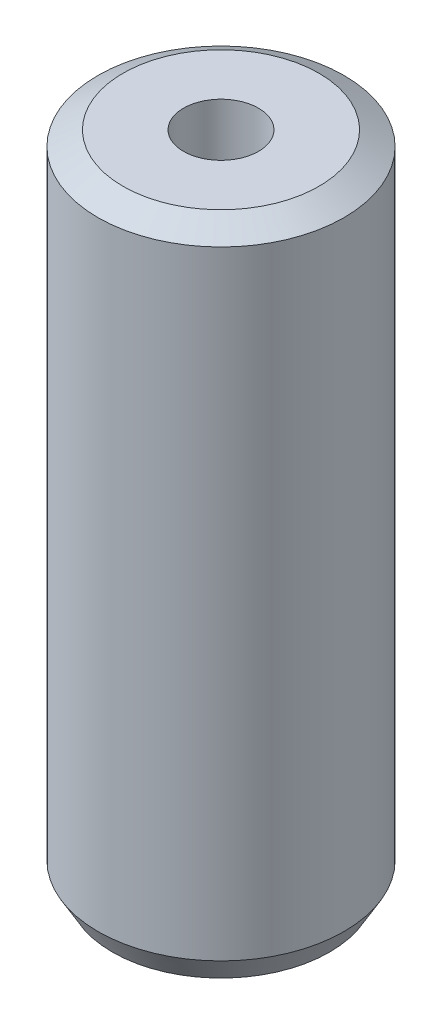
from build123d import *
from OCP.BRepFilletAPI import BRepFilletAPI_MakeChamfer

# Parameters (mm, degrees)
SKETCH1_R           = 10
BOSS_EXTRUDE1_DEPTH = 53.444503897
SKETCH2_R           = 3.044785515
CUT_EXTRUDE1_DEPTH  = 56.283948817
CHAMFER1_SIZE       = 1.177911694
CHAMFER1_SIZE2      = 2.040202901


with BuildPart() as part:
    # Sketch1 → Boss-Extrude1 (new body)
    with BuildSketch(Plane(origin=(0, 0, 0), x_dir=(1, 0, 0), z_dir=(0, 1, 0))):
        Circle(SKETCH1_R)
    extrude(amount=BOSS_EXTRUDE1_DEPTH)

    # Sketch2 → Cut-Extrude1 (cut, through all)
    with BuildSketch(Plane(origin=(0, 0, 0), x_dir=(1, 0, 0), z_dir=(0, 1, 0))):
        Circle(SKETCH2_R)
    extrude(amount=CUT_EXTRUDE1_DEPTH, mode=Mode.SUBTRACT)

    # Chamfer1: one chamfer whose edges measure the first distance from different faces: ONE call of the kernel's chamfer builder (chamfer() names one face for all edges)
    chamfer1_edges_1 = [part.edges().sort_by_distance(p)[0] for p in [
        (-10, 53.444503897, 0),
    ]]
    chamfer1_side_1 = [part.faces().sort_by_distance(p)[0] for p in [
        (-10, 26.722251949, 0),
    ]]
    chamfer1_edges_2 = [part.edges().sort_by_distance(p)[0] for p in [
        (-10, 0, 0),
    ]]
    chamfer1_side_2 = [part.faces().sort_by_distance(p)[0] for p in [
        (-9.717157288, 0, 0),
    ]]
    chamfer1 = BRepFilletAPI_MakeChamfer(part.part.solid().wrapped)
    for e in chamfer1_edges_1:
        chamfer1.Add(CHAMFER1_SIZE, CHAMFER1_SIZE2, e.wrapped, chamfer1_side_1[0].wrapped)  # the first distance lies on this face
    for e in chamfer1_edges_2:
        chamfer1.Add(CHAMFER1_SIZE, CHAMFER1_SIZE2, e.wrapped, chamfer1_side_2[0].wrapped)  # the first distance lies on this face
    add(Compound.cast(chamfer1.Shape()), mode=Mode.REPLACE)


solid = part.part
